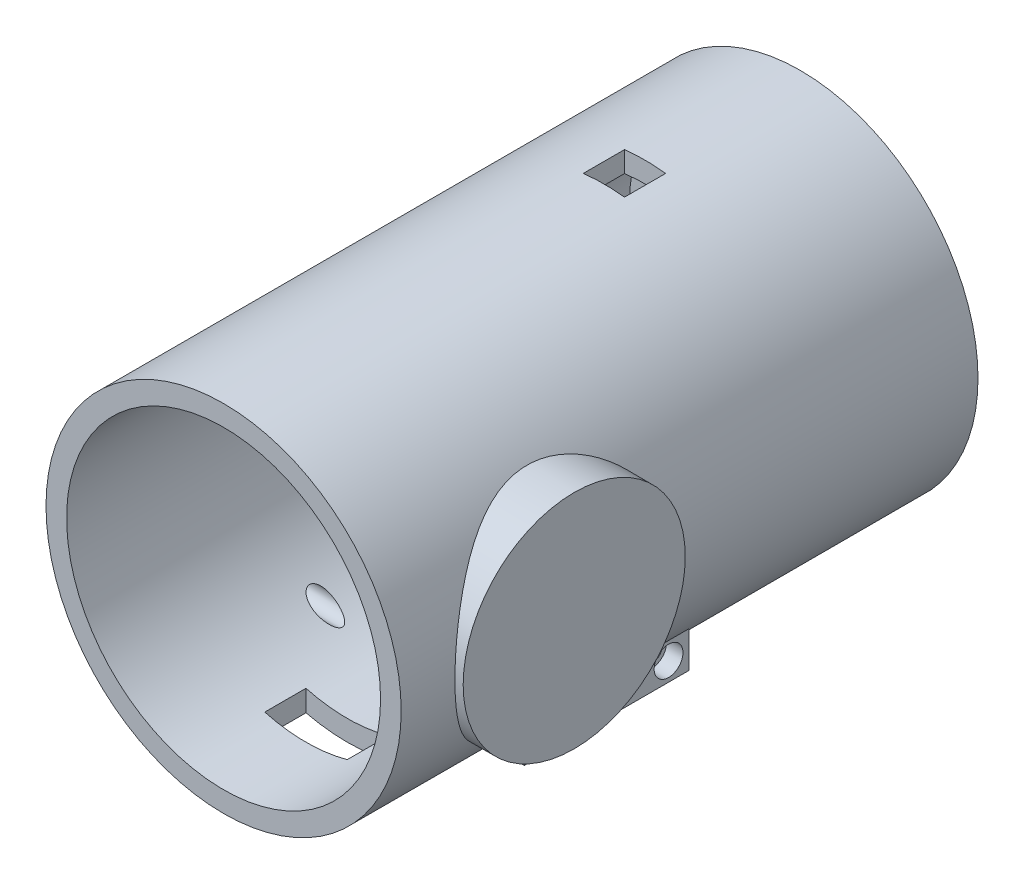
from build123d import *

# Parameters (mm, degrees)
SKETCH1_R                = 43.1
MAIN_BODY_DEPTH          = 140
SKETCH6_W                = 10
SKETCH6_H                = 10
CUT_EXTRUDE3_DEPTH       = 170.964849307
SKETCH8_R                = 26.95
BOSS_EXTRUDE2_DEPTH      = 20
SKETCH5_R                = 31.75
HOLE_1_DEPTH             = 154.269762333
SKETCH10_W               = 20
SKETCH10_H               = 10
MOTOR_WIRE_HOLE_DEPTH    = 154.269762333
BOSS_EXTRUDE9_DEPTH      = 33
BOSS_EXTRUDE9_DEPTH_BACK = 33
SKETCH27_W               = 40
SKETCH27_H               = 9
CUT_EXTRUDE6_DEPTH       = 154.269762333
CUT_EXTRUDE6_DEPTH_BACK  = 154.269762333
SKETCH11_R               = 2.5
CUT_EXTRUDE7_DEPTH       = 3
SKETCH29_R               = 3.5
CUT_EXTRUDE8_DEPTH       = 4
SKETCH2_R                = 38.1
CUT_EXTRUDE5_DEPTH       = 135
BOSS_EXTRUDE3_START      = 10
SKETCH9_R                = 38.1
SKETCH9_R_2              = 36.44
BOSS_EXTRUDE3_DEPTH      = 10


with BuildPart() as part:
    # Sketch1 → Main Body (new body)
    with BuildSketch(Plane.XY):
        Circle(SKETCH1_R)
    extrude(amount=MAIN_BODY_DEPTH)

    # Sketch6 → Cut-Extrude3 (cut, through all)
    with BuildSketch(Plane(origin=(0, 43.1, 0), x_dir=(1, 0, 0), z_dir=(0, 1, 0))):
        with Locations((0, -42.7)):
            Rectangle(SKETCH6_W, SKETCH6_H)
    extrude(amount=-CUT_EXTRUDE3_DEPTH, mode=Mode.SUBTRACT)

    # Sketch8 → Boss-Extrude2 (add)
    with BuildSketch(Plane(origin=(45.1, 0, 0), x_dir=(0, 0, -1), z_dir=(1, 0, 0))):
        with Locations((-100, 0)):
            Circle(SKETCH8_R)
    extrude(amount=-BOSS_EXTRUDE2_DEPTH)

    # Sketch5 → Hole 1 (cut, through all)
    with BuildSketch(Plane.XY.offset(140)):
        Circle(SKETCH5_R)
    extrude(amount=-HOLE_1_DEPTH, mode=Mode.SUBTRACT)

    # Sketch10 → Motor Wire Hole (cut, through all)
    with BuildSketch(Plane(origin=(0, 0, 0), x_dir=(1, 0, 0), z_dir=(0, 1, 0))):
        with Locations((0, -115)):
            Rectangle(SKETCH10_W, SKETCH10_H)
    extrude(amount=-MOTOR_WIRE_HOLE_DEPTH, mode=Mode.SUBTRACT)

    # Sketch27 → Boss-Extrude9 (add, two sides: drawn at the far end of the back side and taken through both)
    with BuildSketch(Plane(origin=(0, 0, 0), x_dir=(0, 0, -1), z_dir=(1, 0, 0)).offset(-BOSS_EXTRUDE9_DEPTH_BACK)):
        with Locations((-80, -32)):
            Rectangle(SKETCH27_W, SKETCH27_H)
    extrude(amount=BOSS_EXTRUDE9_DEPTH + BOSS_EXTRUDE9_DEPTH_BACK)

    # Sketch11 → Cut-Extrude6 (cut, two sides: drawn at the far end of the back side and taken through both)
    with BuildSketch(Plane(origin=(0, 0, 0), x_dir=(0, 0, -1), z_dir=(1, 0, 0)).offset(-CUT_EXTRUDE6_DEPTH_BACK)):
        with Locations((-65, -32)):
            Circle(SKETCH11_R)
        with Locations((-95, -32)):
            Circle(SKETCH11_R)
    extrude(amount=CUT_EXTRUDE6_DEPTH + CUT_EXTRUDE6_DEPTH_BACK, mode=Mode.SUBTRACT)

    # Sketch28 → Cut-Extrude7 (cut)
    with BuildSketch(Plane.ZY.offset(33)):
        Polygon((62.979274058, -28.5), (67.020725942, -28.5), (69.041451884, -32), (67.020725942, -35.5), (62.979274058, -35.5), (60.958548116, -32), align=None)
        Polygon((92.979274058, -28.5), (97.020725942, -28.5), (99.041451884, -32), (97.020725942, -35.5), (92.979274058, -35.5), (90.958548116, -32), align=None)
    extrude(amount=-CUT_EXTRUDE7_DEPTH, mode=Mode.SUBTRACT)

    # Sketch29 → Cut-Extrude8 (cut)
    with BuildSketch(Plane(origin=(33, 0, 0), x_dir=(0, 0, -1), z_dir=(1, 0, 0))):
        with Locations((-95, -32)):
            Circle(SKETCH29_R)
        with Locations((-65, -32)):
            Circle(SKETCH29_R)
    extrude(amount=-CUT_EXTRUDE8_DEPTH, mode=Mode.SUBTRACT)

    # Sketch2 → Cut-Extrude5 (cut)
    with BuildSketch(Plane.XY.offset(140)):
        Circle(SKETCH2_R)
    extrude(amount=-CUT_EXTRUDE5_DEPTH, mode=Mode.SUBTRACT)

    # Sketch9 → Boss-Extrude3 (add)
    with BuildSketch(Plane.XY.offset(5).offset(BOSS_EXTRUDE3_START)):
        Circle(SKETCH9_R)
        Circle(SKETCH9_R_2, mode=Mode.SUBTRACT)
    extrude(amount=-BOSS_EXTRUDE3_DEPTH)


solid = part.part
